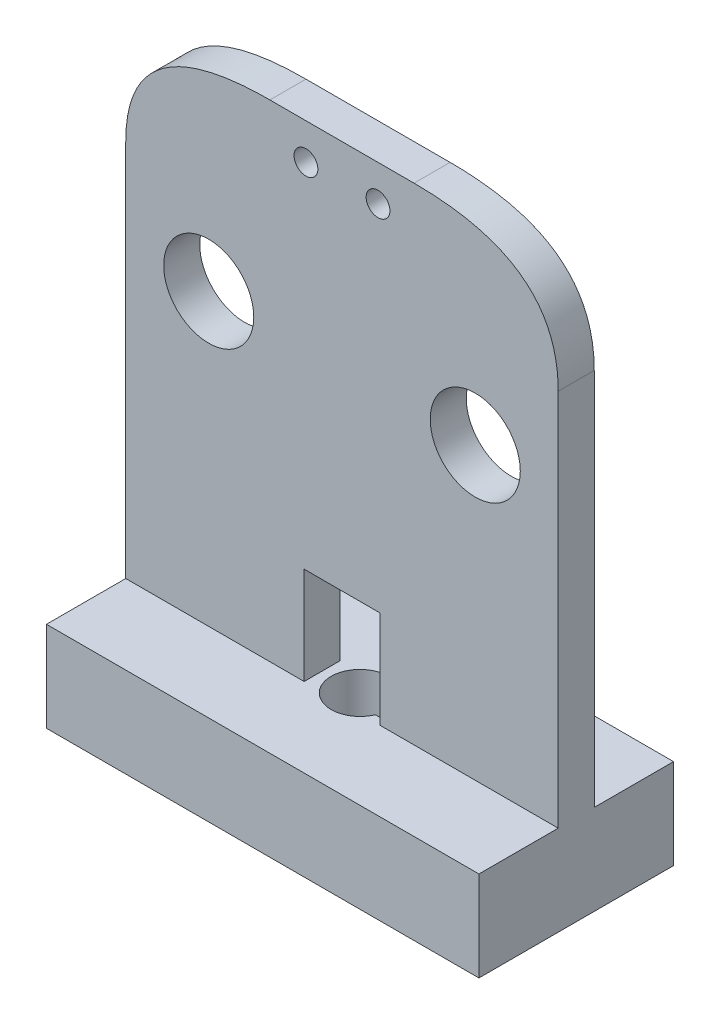
from build123d import *

# Parameters (mm, degrees)
SKIZZE1_W                            = 60
SKIZZE1_H                            = 80
SKIZZE1_R                            = 1.65
SKIZZE1_R_2                          = 6.25
AUFSATZ_LINEAR_AUSTRAGEN1_DEPTH      = 5
VERRUNDUNG1_SIZE                     = 15
VERRUNDUNG1_SIZE_2                   = 20
AUFSATZ_LINEAR_AUSTRAGEN2_DEPTH      = 11
AUFSATZ_LINEAR_AUSTRAGEN2_DEPTH_BACK = 16
SKIZZE2_W                            = 60
SKIZZE2_H                            = 12.5
SCHNITT_LINEAR_AUSTRAGEN1_DEPTH      = 13
SCHNITT_LINEAR_AUSTRAGEN2_DEPTH      = 0.5
SCHNITT_LINEAR_AUSTRAGEN2_DEPTH_BACK = 13
SKIZZE4_W                            = 10.5
SKIZZE4_H                            = 10.5


with BuildPart() as part:
    # Skizze1 → Aufsatz-Linear austragen1 (new body)
    with BuildSketch(Plane.XY):
        Rectangle(SKIZZE1_W, SKIZZE1_H)
        with Locations((-5, 35)):
            Circle(SKIZZE1_R, mode=Mode.SUBTRACT)
        with Locations((5, 35)):
            Circle(SKIZZE1_R, mode=Mode.SUBTRACT)
        with Locations((-18.488104712, 12.772291363)):
            Circle(SKIZZE1_R_2, mode=Mode.SUBTRACT)
        with Locations((18.488104712, 12.772291363)):
            Circle(SKIZZE1_R_2, mode=Mode.SUBTRACT)
    extrude(amount=AUFSATZ_LINEAR_AUSTRAGEN1_DEPTH)

    # Verrundung1
    # a fillet whose section is not a circle: 20, 15 mm, written as the material it takes off along each edge
    with BuildSketch(Plane(origin=(30, 40, -50), x_dir=(0, -1, 0), z_dir=(0, 0, 1))) as verrundung1_piece_1:
        with BuildLine():
            Bezier((VERRUNDUNG1_SIZE, 0), (0, 0), (0, -VERRUNDUNG1_SIZE_2), weights=[1, 1, 1])
            Line((0, -VERRUNDUNG1_SIZE_2), (0, 0))
            Line((0, 0), (VERRUNDUNG1_SIZE, 0))
        make_face()
    extrude(amount=105, mode=Mode.SUBTRACT)
    with BuildSketch(Plane(origin=(-30, 40, -50), x_dir=(1, 0, 0), z_dir=(0, 0, 1))) as verrundung1_piece_2:
        with BuildLine():
            Bezier((VERRUNDUNG1_SIZE_2, 0), (0, 0), (0, -VERRUNDUNG1_SIZE), weights=[1, 1, 1])
            Line((0, -VERRUNDUNG1_SIZE), (0, 0))
            Line((0, 0), (VERRUNDUNG1_SIZE_2, 0))
        make_face()
    extrude(amount=105, mode=Mode.SUBTRACT)

    # Skizze2 → Aufsatz-Linear austragen2 (add, two sides: drawn at the far end of the back side and taken through both)
    with BuildSketch(Plane.XY.offset(5).offset(-AUFSATZ_LINEAR_AUSTRAGEN2_DEPTH_BACK)):
        with Locations((0, -33.75)):
            Rectangle(SKIZZE2_W, SKIZZE2_H)
    extrude(amount=AUFSATZ_LINEAR_AUSTRAGEN2_DEPTH + AUFSATZ_LINEAR_AUSTRAGEN2_DEPTH_BACK)

    # Skizze3 → Schnitt-Linear austragen1 (cut)
    with BuildSketch(Plane.XZ.offset(40)):
        with BuildLine():
            Line((2.8, 4.05), (2.8, 0.95))
            Line((2.8, 0.95), (3.687478813, 0.95))
            ThreePointArc((3.687478813, 0.95), (3.921091382, 1.709403786), (4, 2.5))
            ThreePointArc((4, 2.5), (3.921091382, 3.290596214), (3.687478813, 4.05))
            Line((3.687478813, 4.05), (2.8, 4.05))
        make_face()
        with BuildLine():
            Line((3.687478813, 0.95), (2.8, 0.95))
            Line((2.8, 0.95), (2.8, 4.05))
            Line((2.8, 4.05), (3.687478813, 4.05))
            ThreePointArc((3.687478813, 4.05), (-4, 2.5), (3.687478813, 0.95))
        make_face()
        with BuildLine():
            ThreePointArc((4, 2.5), (3.921091382, 1.709403786), (3.687478813, 0.95))
            Line((3.687478813, 0.95), (5.2, 0.95))
            Line((5.2, 0.95), (5.2, 4.05))
            Line((5.2, 4.05), (3.687478813, 4.05))
            ThreePointArc((3.687478813, 4.05), (3.921091382, 3.290596214), (4, 2.5))
        make_face()
    extrude(amount=-SCHNITT_LINEAR_AUSTRAGEN1_DEPTH, mode=Mode.SUBTRACT)

    # Skizze4 → Schnitt-Linear austragen2 (cut, two sides: drawn at the far end of the back side and taken through both)
    with BuildSketch(Plane.XZ.offset(27).offset(-SCHNITT_LINEAR_AUSTRAGEN2_DEPTH_BACK)):
        with Locations((0, 2.5)):
            Rectangle(SKIZZE4_W, SKIZZE4_H)
    extrude(amount=SCHNITT_LINEAR_AUSTRAGEN2_DEPTH + SCHNITT_LINEAR_AUSTRAGEN2_DEPTH_BACK, mode=Mode.SUBTRACT)


solid = part.part
